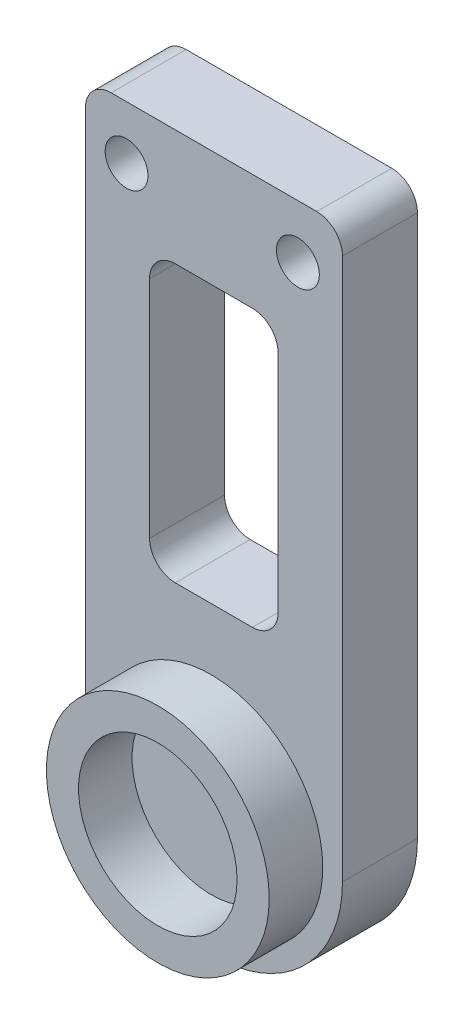
from build123d import *

# Parameters (mm, degrees)
SKETCH1_W           = 12
SKETCH1_H           = 32.5
SKETCH1_R           = 1
SKETCH1_W_2         = 6
SKETCH1_H_2         = 12.9
BOSS_EXTRUDE1_DEPTH = 3.5
FILLET1_R           = 1.2
FILLET2_R           = 6
SKETCH2_R           = 5.2
SKETCH2_R_2         = 3.7
BOSS_EXTRUDE2_DEPTH = 2.5


with BuildPart() as part:
    # Sketch1 → Boss-Extrude1 (new body)
    with BuildSketch(Plane.XY.offset(10)):
        with Locations((-276.988860295, 267.101135254)):
            Rectangle(SKETCH1_W, SKETCH1_H)
        with Locations((-281.069234982, 280.854420413)):
            Circle(SKETCH1_R, mode=Mode.SUBTRACT)
        with Locations((-273.069234982, 280.854420413)):
            Circle(SKETCH1_R, mode=Mode.SUBTRACT)
        with Locations((-276.994472892, 271.487209026)):
            Rectangle(SKETCH1_W_2, SKETCH1_H_2, mode=Mode.SUBTRACT)
    extrude(amount=BOSS_EXTRUDE1_DEPTH)

    # Fillet1
    fillet1_edges = [part.edges().sort_by_distance(p)[0] for p in [
        (-279.994472892, 277.937209026, 11.75),
        (-279.994472892, 265.037209026, 11.75),
        (-273.994472892, 265.037209026, 11.75),
        (-273.994472892, 277.937209026, 11.75),
        (-282.988860295, 283.351135254, 11.75),
        (-270.988860295, 283.351135254, 11.75),
    ]]
    fillet(fillet1_edges, radius=FILLET1_R)

    # Fillet2
    fillet2_edges = [part.edges().sort_by_distance(p)[0] for p in [
        (-282.988860295, 250.851135254, 11.75),
        (-270.988860295, 250.851135254, 11.75),
    ]]
    fillet(fillet2_edges, radius=FILLET2_R - 0.0001)  # a hair under: the kernel refuses the full size

    # Sketch2 → Boss-Extrude2 (add)
    with BuildSketch(Plane.XY.offset(13.5)):
        with Locations((-277.110164077, 256.96399239)):
            Circle(SKETCH2_R)
        with Locations((-277.110164077, 256.96399239)):
            Circle(SKETCH2_R_2, mode=Mode.SUBTRACT)
    extrude(amount=BOSS_EXTRUDE2_DEPTH)


solid = part.part
